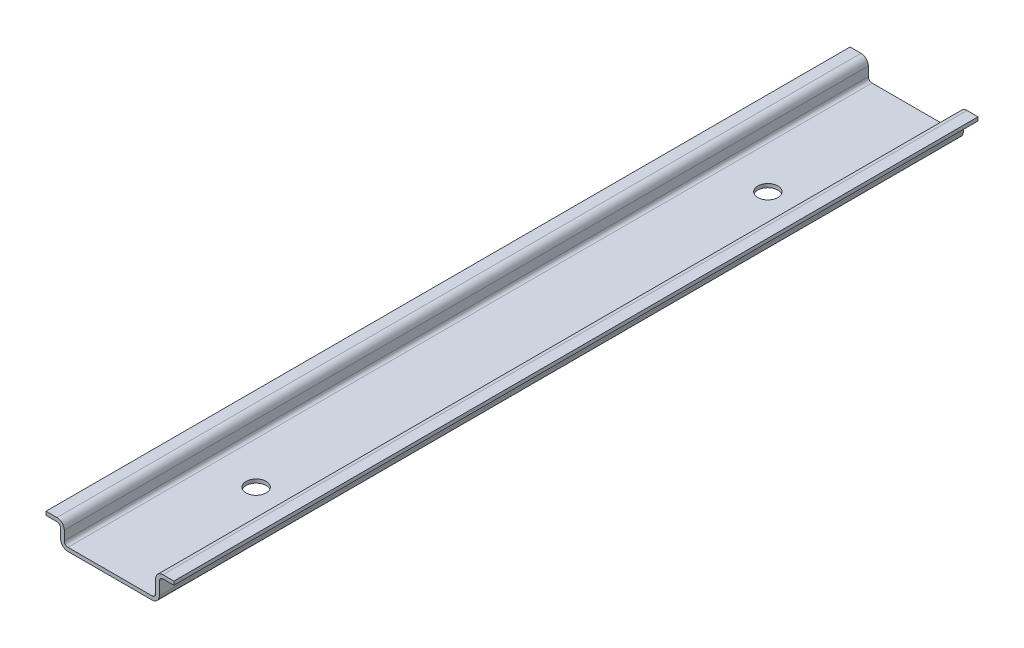
from build123d import *

# Parameters (mm, degrees)
BOSS_EXTRUDE1_DEPTH = 220
SKETCH2_R           = 2.75
CUT_EXTRUDE1_DEPTH  = 1


with BuildPart() as part:
    # Sketch1 → Boss-Extrude1 (new body)
    with BuildSketch(Plane.XY):
        with BuildLine():
            Line((2, 0), (25, 0))
            ThreePointArc((25, 0), (26.414213562, 0.585786438), (27, 2))
            Line((27, 2), (27, 5.5))
            ThreePointArc((27, 5.5), (27.292893219, 6.207106781), (28, 6.5))
            Line((28, 6.5), (31, 6.5))
            Line((31, 6.5), (31, 7.5))
            Line((31, 7.5), (28, 7.5))
            ThreePointArc((28, 7.5), (26.585786438, 6.914213562), (26, 5.5))
            Line((26, 5.5), (26, 2))
            ThreePointArc((26, 2), (25.707106781, 1.292893219), (25, 1))
            Line((25, 1), (2, 1))
            ThreePointArc((2, 1), (1.292893219, 1.292893219), (1, 2))
            Line((1, 2), (1, 4.544540718))
            ThreePointArc((1, 4.544540718), (0.414213562, 5.95875428), (-1, 6.544540718))
            Line((-1, 6.544540718), (-4, 6.544540718))
            Line((-4, 6.544540718), (-4, 5.544540718))
            Line((-4, 5.544540718), (-1, 5.544540718))
            ThreePointArc((-1, 5.544540718), (-0.292893219, 5.251647499), (0, 4.544540718))
            Line((0, 4.544540718), (0, 2))
            ThreePointArc((0, 2), (0.585786438, 0.585786438), (2, 0))
        make_face()
    extrude(amount=BOSS_EXTRUDE1_DEPTH)

    # Sketch2 → Cut-Extrude1 (cut)
    with BuildSketch(Plane(origin=(0, 1, 0), x_dir=(1, 0, 0), z_dir=(0, 1, 0))):
        with Locations((13.5, -40)):
            Circle(SKETCH2_R)
        with Locations((13.5, -180)):
            Circle(SKETCH2_R)
    extrude(amount=-CUT_EXTRUDE1_DEPTH, mode=Mode.SUBTRACT)


solid = part.part
